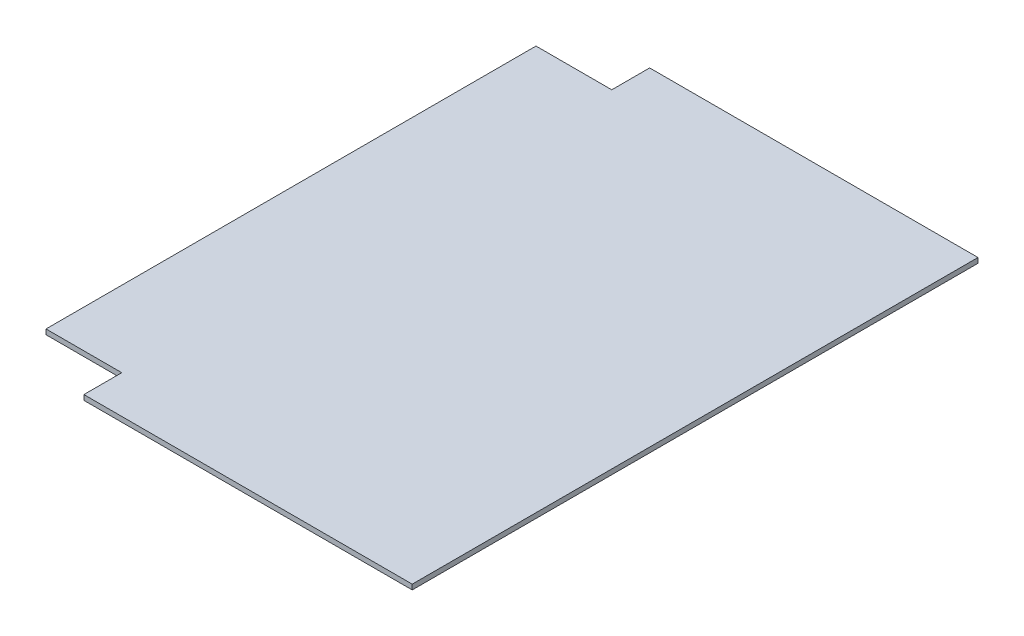
from build123d import *

# Parameters (mm, degrees)
SKETCH1_W           = 160
SKETCH1_H           = 224
BOSS_EXTRUDE1_DEPTH = 1
SKETCH41_W          = 30
SKETCH41_H          = 15
CUT_EXTRUDE2_DEPTH  = 40


with BuildPart() as part:
    # Sketch1 → Boss-Extrude1 (new, symmetric)
    with BuildSketch(Plane(origin=(0, 0, 0), x_dir=(1, 0, 0), z_dir=(0, 1, 0))):
        Rectangle(SKETCH1_W, SKETCH1_H)
    extrude(amount=BOSS_EXTRUDE1_DEPTH, both=True)

    # Sketch41 → Cut-Extrude2 (cut)
    with BuildSketch(Plane(origin=(0, 1, 0), x_dir=(1, 0, 0), z_dir=(0, 1, 0))):
        with Locations((-65, -104.5)):
            Rectangle(SKETCH41_W, SKETCH41_H)
        with Locations((-65, 104.5)):
            Rectangle(SKETCH41_W, SKETCH41_H)
    extrude(amount=-CUT_EXTRUDE2_DEPTH, mode=Mode.SUBTRACT)


solid = part.part
